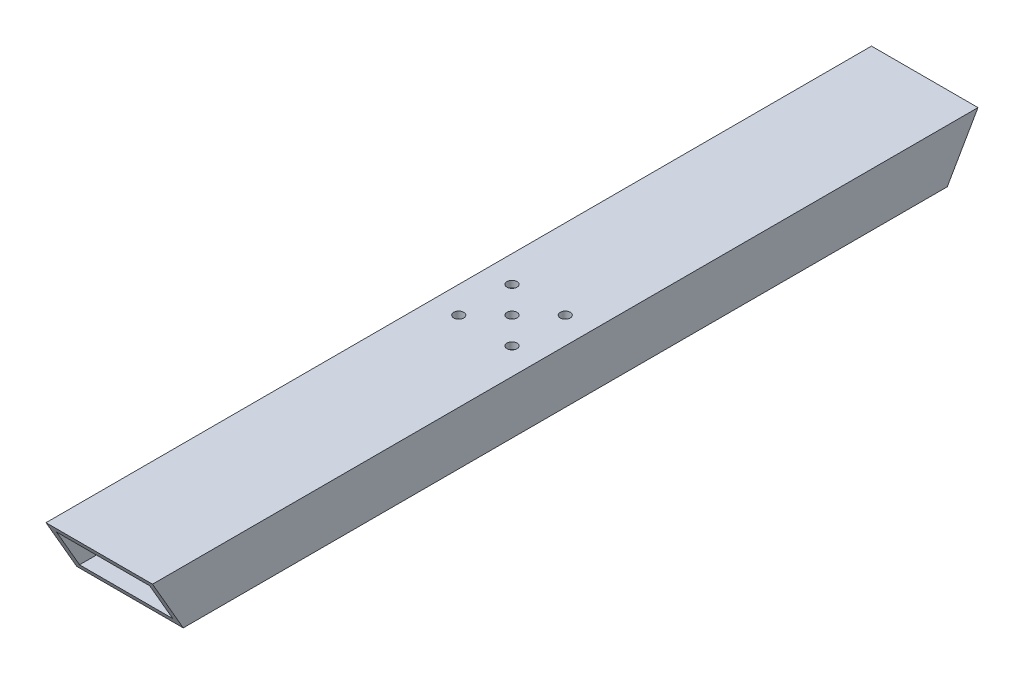
from build123d import *

# Parameters (mm, degrees)
SKETCH1_W           = 50.8
SKETCH1_H           = 25.4
SKETCH1_W_2         = 44.45
SKETCH1_H_2         = 19.05
BOSS_EXTRUDE1_DEPTH = 393.7
CUT_EXTRUDE1_DEPTH  = 457.2
SKETCH3_R           = 2.38125
CUT_EXTRUDE2_DEPTH  = 396.335313373
SKETCH4_R           = 2.38125
CUT_EXTRUDE3_DEPTH  = 3.175


with BuildPart() as part:
    # Sketch1 → Boss-Extrude1 (new body)
    with BuildSketch(Plane.XY):
        Rectangle(SKETCH1_W, SKETCH1_H)
        Rectangle(SKETCH1_W_2, SKETCH1_H_2, mode=Mode.SUBTRACT)
    extrude(amount=BOSS_EXTRUDE1_DEPTH)

    # Sketch2 → Cut-Extrude1 (cut)
    with BuildSketch(Plane(origin=(25.4, 0, 0), x_dir=(0, 0, -1), z_dir=(1, 0, 0))):
        Polygon((0, 12.7), (-14.664696837, -12.7), (0, -12.7), align=None)
        Polygon((-393.7, -12.7), (-393.7, 12.7), (-379.035303163, -12.7), align=None)
    extrude(amount=-CUT_EXTRUDE1_DEPTH, mode=Mode.SUBTRACT)

    # Sketch3 → Cut-Extrude2 (cut, through all)
    with BuildSketch(Plane(origin=(0, -12.7, 0), x_dir=(-1, 0, 0), z_dir=(0, -1, 0))):
        with Locations((0, -196.85)):
            Circle(SKETCH3_R)
        with Locations((-12.7, -209.55)):
            Circle(SKETCH3_R)
        with Locations((12.7, -209.55)):
            Circle(SKETCH3_R)
        with Locations((-12.7, -184.15)):
            Circle(SKETCH3_R)
        with Locations((12.7, -184.15)):
            Circle(SKETCH3_R)
    extrude(amount=-CUT_EXTRUDE2_DEPTH, mode=Mode.SUBTRACT)

    # Sketch4 → Cut-Extrude3 (cut)
    with BuildSketch(Plane.ZY.offset(25.4)):
        with Locations((196.85, 0)):
            Circle(SKETCH4_R)
        with Locations((209.55, 0)):
            Circle(SKETCH4_R)
        with Locations((184.15, 0)):
            Circle(SKETCH4_R)
    extrude(amount=-CUT_EXTRUDE3_DEPTH, mode=Mode.SUBTRACT)


solid = part.part
